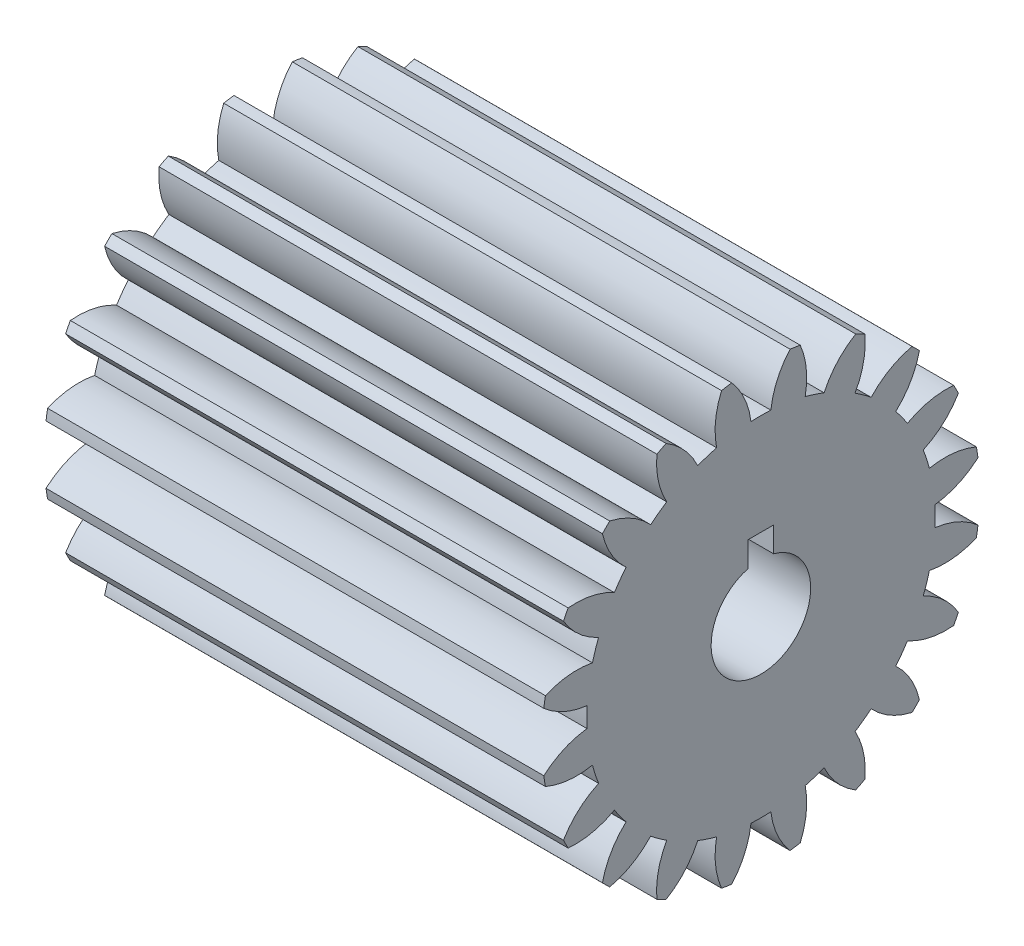
from build123d import *

# Parameters (mm, degrees)
BASPROSKE_W        = 10
BASPROSKE_H        = 4.4
TOOTHCUT_DEPTH     = 12.777945491
TEETHCUTS_COUNT    = 20
TEETHCUTS_ANGLE    = 342
BORSKE_R           = 1
BORE_DEPTH         = 50.0000508
SKETCH1_W          = 0.51
SKETCH1_H          = 0.51
CUT_EXTRUDE1_DEPTH = 100


with BuildPart() as part:
    # BasProSke → Base-Revolve (revolve)
    with BuildSketch(Plane(origin=(0, 0, 0), x_dir=(1, 0, 0), z_dir=(0, 1, 0))):
        with Locations((5, 2.2)):
            Rectangle(BASPROSKE_W, BASPROSKE_H)
    revolve(axis=Axis((-10, 0, 0), (1, 0, 0)))

    # TooCutSke → ToothCut (cut, through all)
    with BuildSketch(Plane(origin=(0, 0, 0), x_dir=(0, 0, -1), z_dir=(1, 0, 0))):
        with BuildLine():
            ThreePointArc((0.199592598, 3.493302706), (0, 3.499), (-0.199592598, 3.493302706))
            ThreePointArc((-0.199592598, 3.493302706), (-0.333052166, 3.970347354), (-0.606028648, 4.383707841))
            ThreePointArc((-0.606028648, 4.383707841), (0, 4.4254), (0.606028648, 4.383707841))
            ThreePointArc((0.606028648, 4.383707841), (0.333052166, 3.970347354), (0.199592598, 3.493302706))
        make_face()
    toothcut = extrude(amount=TOOTHCUT_DEPTH, mode=Mode.SUBTRACT)

    # TeethCuts: ToothCut ×20 about axis
    teethcuts_axis = Axis((-10, 0, 0), (1, 0, 0))
    for i in range(1, TEETHCUTS_COUNT):
        add(toothcut.rotate(teethcuts_axis, i * TEETHCUTS_ANGLE / (TEETHCUTS_COUNT - 1)), mode=Mode.SUBTRACT)

    # BorSke → Bore (cut, symmetric)
    with BuildSketch(Plane(origin=(0, 0, 0), x_dir=(0, 0, -1), z_dir=(1, 0, 0))):
        Circle(BORSKE_R)
    extrude(amount=BORE_DEPTH, both=True, mode=Mode.SUBTRACT)

    # Sketch1 → Cut-Extrude1 (cut)
    with BuildSketch(Plane(origin=(10, 0, 0), x_dir=(0, 0, -1), z_dir=(1, 0, 0))):
        with Locations((0, 1.213665218)):
            Rectangle(SKETCH1_W, SKETCH1_H)
    extrude(amount=-CUT_EXTRUDE1_DEPTH, mode=Mode.SUBTRACT)


solid = part.part
